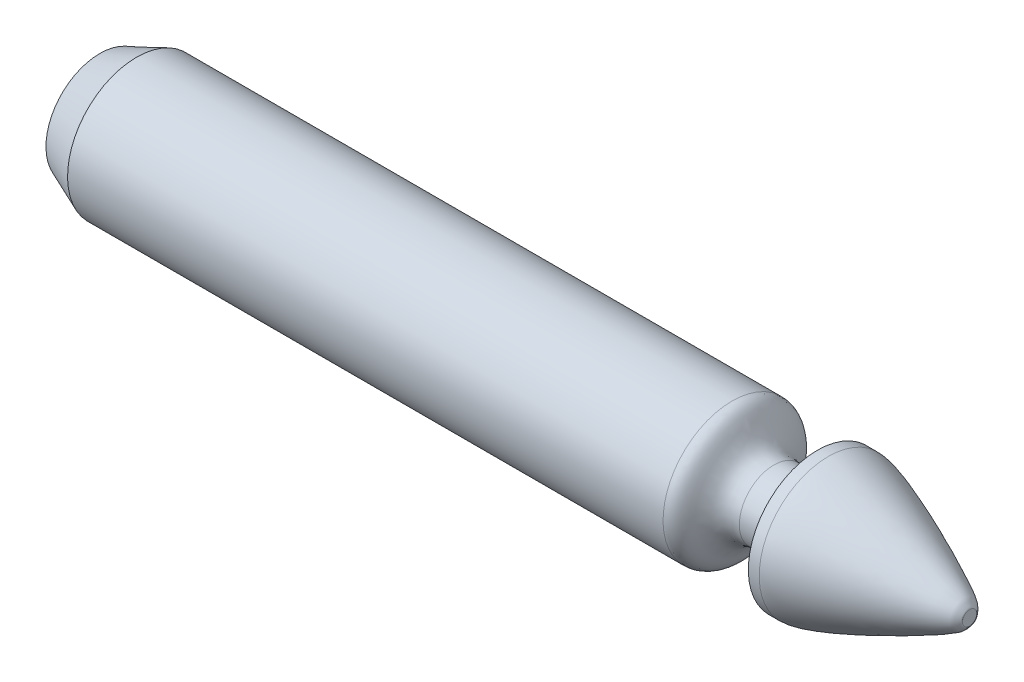
from build123d import *


with BuildPart() as part:
    # body_sketch → body (revolve)
    with BuildSketch(Plane.XY):
        with BuildLine():
            Line((-6.5, 3.175), (-7, 3.175))
            Line((-7, 3.175), (-7, 1.5875))
            Line((-7, 1.5875), (-9, 1.5875))
            add(Edge.make_bspline(
                [(-10.921788615, 3.175), (-10.052531478, 3.175), (-10.250040485, 1.5875), (-9, 1.5875)],
                knots=[0, 0, 0, 0, 1, 1, 1, 1], degree=3))
            Line((-10.921788615, 3.175), (-38.309951565, 3.175))
            Line((-38.309951565, 3.175), (-40, 2.477839401))
            Line((-40, 2.477839401), (-40, 0))
            Line((-40, 0), (0, 0))
            Line((0, 0), (0, 0.327812847))
            add(Edge.make_bspline(
                [(-6.5, 3.175), (-5.484084378, 3.175), (-0.454332814, 0.896409492), (-0.05462572, 0.424300736), (0, 0.377250903), (0, 0.327812847)],
                knots=[0, 0, 0, 0, 0.586137631, 0.686137631, 1, 1, 1, 1], degree=3))
        make_face()
    revolve(axis=Axis((0, 0, 0), (-1, 0, 0)))


solid = part.part
